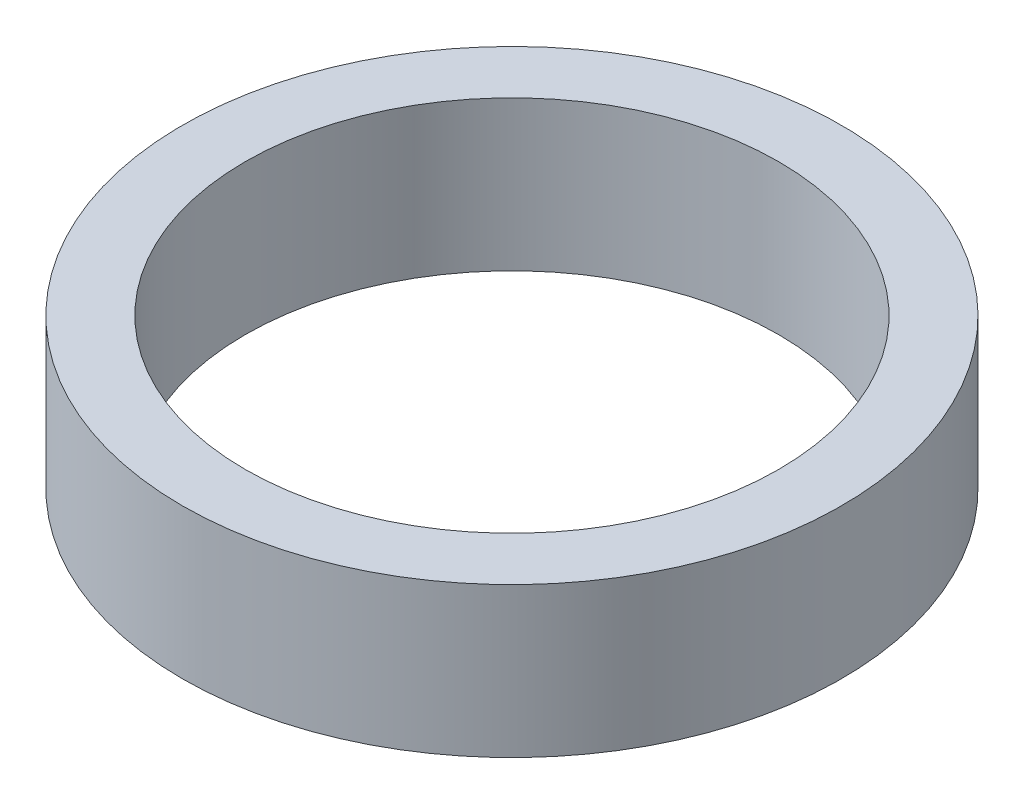
from build123d import *

# Parameters (mm, degrees)
SKETCH1_R           = 11
SKETCH1_R_2         = 8.9
BOSS_EXTRUDE1_DEPTH = 5


with BuildPart() as part:
    # Sketch1 → Boss-Extrude1 (new body)
    with BuildSketch(Plane(origin=(0, 0, 0), x_dir=(1, 0, 0), z_dir=(0, 1, 0))):
        Circle(SKETCH1_R)
        Circle(SKETCH1_R_2, mode=Mode.SUBTRACT)
    extrude(amount=BOSS_EXTRUDE1_DEPTH)


solid = part.part
